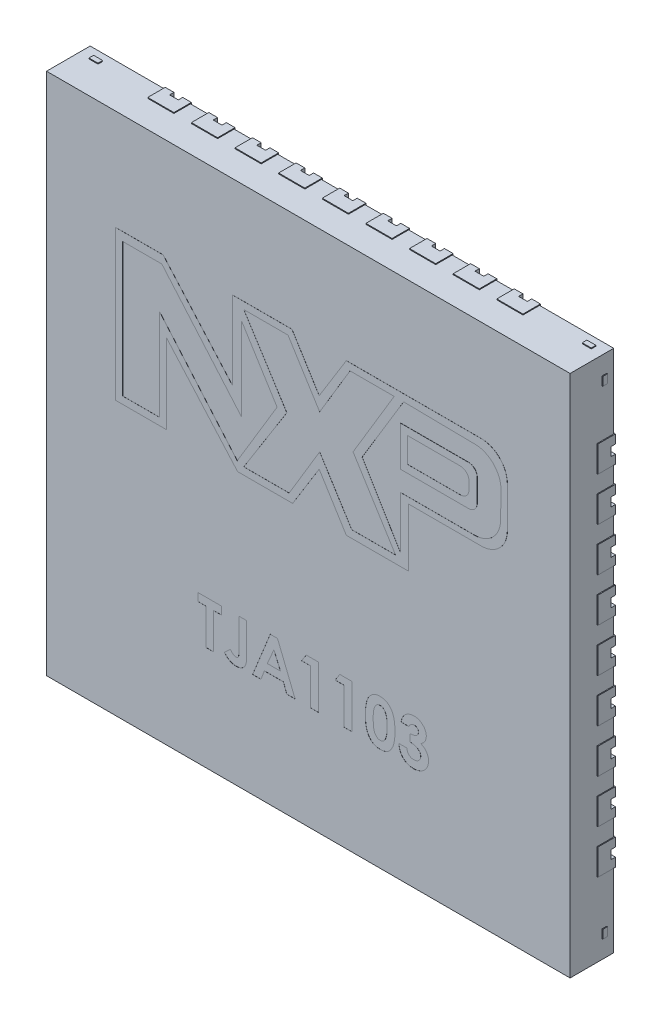
from build123d import *

# Parameters (mm, degrees)
SKETCH1_W           = 6
SKETCH1_H           = 6
BOSS_EXTRUDE1_DEPTH = 0.5
CUT_EXTRUDE2_DEPTH  = 0.001
BOSS_EXTRUDE2_DEPTH = 0.001
CUT_EXTRUDE3_DEPTH  = 0.001
BOSS_EXTRUDE3_DEPTH = 0.002
BOSS_EXTRUDE4_DEPTH = 0.01
SKETCH11_W          = 9.358912621
SKETCH11_H          = 9.422291262
SKETCH11_W_2        = 6
SKETCH11_H_2        = 6
CUT_EXTRUDE4_DEPTH  = 10.01
SKETCH14_W          = 0.3
SKETCH14_H          = 0.2
BOSS_EXTRUDE5_DEPTH = 0.01
SKETCH15_W          = 0.2
SKETCH15_H          = 0.3
BOSS_EXTRUDE6_DEPTH = 0.01
CUT_EXTRUDE6_DEPTH  = 0.05
SKETCH17_W          = 0.102885944
SKETCH17_H          = 0.053280221
BOSS_EXTRUDE7_DEPTH = 0.01
SKETCH18_W          = 0.053280221
SKETCH18_H          = 0.097122664
BOSS_EXTRUDE8_DEPTH = 0.01


with BuildPart() as part:
    # Sketch1 → Boss-Extrude1 (new body)
    with BuildSketch(Plane.XY):
        Rectangle(SKETCH1_W, SKETCH1_H)
    extrude(amount=BOSS_EXTRUDE1_DEPTH)

    # Sketch4 → Cut-Extrude2 (cut)
    with BuildSketch(Plane(origin=(0, 0, 0), x_dir=(-1, 0, 0), z_dir=(0, 0, -1))):
        with BuildLine():
            Line((-1.632420425, 1.980816377), (1.632420425, 1.980816377))
            ThreePointArc((1.632420425, 1.980816377), (1.809197121, 1.907593072), (1.882420425, 1.730816377))
            Line((1.882420425, 1.730816377), (1.882420425, 1.473194929))
            ThreePointArc((1.882420425, 1.473194929), (1.863122952, 1.414143238), (1.81267838, 1.377882515))
            ThreePointArc((1.81267838, 1.377882515), (1.651928824, 1.158195408), (1.81267838, 0.9385083))
            ThreePointArc((1.81267838, 0.9385083), (1.863122952, 0.902247578), (1.882420425, 0.843195886))
            Line((1.882420425, 0.843195886), (1.882420425, -1.730816377))
            ThreePointArc((1.882420425, -1.730816377), (1.809197121, -1.907593072), (1.632420425, -1.980816377))
            Line((1.632420425, -1.980816377), (-1.632420425, -1.980816377))
            ThreePointArc((-1.632420425, -1.980816377), (-1.809197121, -1.907593072), (-1.882420425, -1.730816377))
            Line((-1.882420425, -1.730816377), (-1.882420425, 1.730816377))
            ThreePointArc((-1.882420425, 1.730816377), (-1.809197121, 1.907593072), (-1.632420425, 1.980816377))
        make_face()
    extrude(amount=-CUT_EXTRUDE2_DEPTH, mode=Mode.SUBTRACT)

    # Sketch6 → Boss-Extrude2 (add)
    # profile 1 of 2: a face of its own
    with BuildSketch(Plane.XY.offset(0.5)):
        with BuildLine():
            Line((-2.208307901, 1.845529629), (-2.208307901, 0.13028037))
            Line((-2.208307901, 0.13028037), (-1.626258533, 0.13028037))
            Line((-1.626258533, 0.13028037), (-1.626258533, 1.045395534))
            Line((-1.626258533, 1.045395534), (-0.809326621, 0.121554782))
            Line((-0.809326621, 0.121554782), (-0.178530199, 0.121554782))
            Line((-0.178530199, 0.121554782), (0.125471171, 0.613755741))
            Line((0.125471171, 0.613755741), (0.436261306, 0.112710429))
            Line((0.436261306, 0.112710429), (1.148042249, 0.112710429))
            Line((1.148042249, 0.112710429), (1.148042249, 0.779423917))
            Line((1.148042249, 0.779423917), (1.981741709, 0.779423917))
            ThreePointArc((1.981741709, 0.779423917), (2.193873744, 0.867291883), (2.281741709, 1.079423917))
            Line((2.281741709, 1.079423917), (2.281741709, 1.545529629))
            ThreePointArc((2.281741709, 1.545529629), (2.193873744, 1.757661663), (1.981741709, 1.845529629))
            Line((1.981741709, 1.845529629), (0.436261306, 1.845529629))
            Line((0.436261306, 1.845529629), (0.125471171, 1.342337153))
            Line((0.125471171, 1.342337153), (-0.186650813, 1.845529629))
            Line((-0.186650813, 1.845529629), (-0.8659796, 1.845529629))
            Line((-0.8659796, 1.845529629), (-0.8659796, 0.944137734))
            Line((-0.8659796, 0.944137734), (-1.663060485, 1.845529629))
            Line((-1.663060485, 1.845529629), (-2.208307901, 1.845529629))
        make_face()
        Polygon((-1.703941314, 0.212969588), (-2.126234991, 0.212969588), (-2.126234991, 1.747783971), (-1.677731742, 1.747783971), (-0.764251952, 0.686588082), (-0.764251952, 1.640514179), (-0.356666128, 0.987426307), (-0.813519915, 0.227161378), (-1.703941314, 1.261570173), align=None, mode=Mode.SUBTRACT)
        Polygon((-0.245781204, 0.987426307), (-0.738994909, 1.765579058), (-0.231779744, 1.765579058), (0.130879269, 1.185075323), (0.478894984, 1.765579058), (0.985194292, 1.765579058), (0.513824476, 0.979315892), (1.00127257, 0.199063838), (0.498293295, 0.199063838), (0.130879269, 0.787178864), (-0.218681012, 0.204098736), (-0.738994909, 0.204098736), align=None, mode=Mode.SUBTRACT)
        with BuildLine():
            Line((0.61729453, 0.979315892), (1.093525415, 1.765579058))
            Line((1.093525415, 1.765579058), (1.913234367, 1.754090362))
            ThreePointArc((1.913234367, 1.754090362), (2.12411417, 1.663258164), (2.209000646, 1.449915562))
            Line((2.209000646, 1.449915562), (2.204711866, 1.143914681))
            ThreePointArc((2.204711866, 1.143914681), (2.115381686, 0.934505648), (1.904741327, 0.848118942))
            Line((1.904741327, 0.848118942), (1.059921224, 0.848118942))
            Line((1.059921224, 0.848118942), (1.059921224, 0.245206429))
            Line((1.059921224, 0.245206429), (0.61729453, 0.979315892))
        make_face(mode=Mode.SUBTRACT)
    # profile 2 of 2: a face of its own
    with BuildSketch(Plane.XY.offset(0.5)):
        with BuildLine():
            Line((1.743735016, 1.454393746), (1.140257386, 1.454393746))
            Line((1.140257386, 1.454393746), (1.140257386, 1.167858098))
            Line((1.140257386, 1.167858098), (1.743735016, 1.167858098))
            ThreePointArc((1.743735016, 1.167858098), (1.814445694, 1.19714742), (1.843735016, 1.267858098))
            Line((1.843735016, 1.267858098), (1.843735016, 1.354393746))
            ThreePointArc((1.843735016, 1.354393746), (1.814445694, 1.425104424), (1.743735016, 1.454393746))
        make_face()
    extrude(amount=BOSS_EXTRUDE2_DEPTH)

    # Sketch8 → Cut-Extrude3 (cut)
    # profile 1 of 7: a face of its own
    with BuildSketch(Plane.XY.offset(0.5)):
        Polygon((-1.263317536, -1.306398608), (-0.994086767, -1.306398608), (-0.994086767, -1.396142198), (-1.083830357, -1.396142198), (-1.083830357, -1.806398608), (-1.173573947, -1.806398608), (-1.173573947, -1.396142198), (-1.263317536, -1.396142198), align=None)
    # profile 2 of 7: a face of its own
    with BuildSketch(Plane.XY.offset(0.5)):
        with BuildLine():
            Line((-0.795368818, -1.306398608), (-0.705625229, -1.306398608))
            Line((-0.705625229, -1.306398608), (-0.705625229, -1.638329698))
            add(Edge.make_bspline(
                [(-0.705625229, -1.638329698), (-0.705658131, -1.644673799), (-0.705721528, -1.656897628), (-0.706356245, -1.674495431), (-0.707214493, -1.690629989), (-0.708450454, -1.705275451), (-0.710286194, -1.718431108), (-0.712363694, -1.730129782), (-0.714655753, -1.740419142), (-0.718527604, -1.751934537), (-0.724538539, -1.764686527), (-0.733609213, -1.778460488), (-0.744905105, -1.790427713), (-0.757914242, -1.800822632), (-0.772746234, -1.809053441), (-0.789059389, -1.815002691), (-0.806801556, -1.818556815), (-0.819090237, -1.818994028), (-0.825416895, -1.819219121)],
                knots=[0, 0, 0, 0, 1.22248561, 2.355488409, 3.392943897, 4.335991845, 5.186735882, 5.951517034, 6.625683685, 7.215700098, 8.28923535, 9.333114649, 10.380102123, 11.447198135, 12.530158036, 13.633358744, 14.781567393, 16, 16, 16, 16], degree=3))
            add(Edge.make_bspline(
                [(-0.825416895, -1.819219121), (-0.832008697, -1.819015046), (-0.845010305, -1.818612531), (-0.864078502, -1.815184139), (-0.882405423, -1.809687394), (-0.899896254, -1.80173976), (-0.916790625, -1.791784276), (-0.932781918, -1.779435466), (-0.94820401, -1.765076322), (-0.95734632, -1.754057475), (-0.962035485, -1.74840582)],
                knots=[0, 0, 0, 0, 0.990984786, 1.954608977, 2.90473533, 3.862451285, 4.837525908, 5.848096122, 6.896271184, 8, 8, 8, 8], degree=3))
            Line((-0.962035485, -1.74840582), (-0.894126831, -1.685605339))
            add(Edge.make_bspline(
                [(-0.894126831, -1.685605339), (-0.890571211, -1.689625741), (-0.883917689, -1.697148996), (-0.873891028, -1.706959504), (-0.864846439, -1.714841115), (-0.856320386, -1.720526192), (-0.848274554, -1.724533536), (-0.840535831, -1.727420139), (-0.832862992, -1.729054121), (-0.82779408, -1.729337187), (-0.825316735, -1.729475531)],
                knots=[0, 0, 0, 0, 1.529509877, 2.862124173, 3.996688592, 4.944357383, 5.774364335, 6.554177287, 7.293378699, 8, 8, 8, 8], degree=3))
            add(Edge.make_bspline(
                [(-0.825316735, -1.729475531), (-0.822918941, -1.72935049), (-0.818308772, -1.729110077), (-0.811969612, -1.726437583), (-0.806625293, -1.722241655), (-0.803106908, -1.717417891), (-0.800864766, -1.712486705), (-0.799463833, -1.707719957), (-0.798134346, -1.702005917), (-0.79706919, -1.69534745), (-0.796264357, -1.687657705), (-0.795863205, -1.679030035), (-0.795375354, -1.669417818), (-0.795371074, -1.66270285), (-0.795368818, -1.659163031)],
                knots=[0, 0, 0, 0, 1.003927327, 1.930222208, 2.840933547, 3.835773585, 4.407906147, 5.114514582, 5.922289074, 6.876303333, 7.950072246, 9.174518422, 10.510537432, 12, 12, 12, 12], degree=3))
            Line((-0.795368818, -1.659163031), (-0.795368818, -1.306398608))
        make_face()
    # profile 3 of 7: a face of its own
    with BuildSketch(Plane.XY.offset(0.5)):
        Polygon((-0.436294299, -1.306398608), (-0.353061126, -1.306398608), (-0.151138049, -1.806398608), (-0.246991414, -1.806398608), (-0.285853594, -1.703834506), (-0.503702152, -1.703834506), (-0.542564331, -1.806398608), (-0.638317536, -1.806398608), align=None)
        Polygon((-0.394727793, -1.440513191), (-0.469647664, -1.614090916), (-0.319807921, -1.614090916), align=None, mode=Mode.SUBTRACT)
    # profile 4 of 7: a face of its own
    with BuildSketch(Plane.XY.offset(0.5)):
        Polygon((-0.023834363, -1.306398608), (0.114887592, -1.306398608), (0.114887592, -1.806398608), (0.025144002, -1.806398608), (0.025144002, -1.389731941), (-0.0774201, -1.389731941), align=None)
    # profile 5 of 7: a face of its own
    with BuildSketch(Plane.XY.offset(0.5)):
        Polygon((0.360781021, -1.306398608), (0.499502977, -1.306398608), (0.499502977, -1.806398608), (0.409759387, -1.806398608), (0.409759387, -1.389731941), (0.307195284, -1.389731941), align=None)
    # profile 6 of 7: a face of its own
    with BuildSketch(Plane.XY.offset(0.5)):
        with BuildLine():
            add(Edge.make_bspline(
                [(0.821718521, -1.293578095), (0.826062484, -1.293642583), (0.834603874, -1.293769382), (0.847183734, -1.295142722), (0.859301618, -1.297217456), (0.871004931, -1.300110987), (0.882209433, -1.303940471), (0.892996672, -1.308524299), (0.903238248, -1.3141029), (0.913064775, -1.320404217), (0.922472467, -1.327538201), (0.931235217, -1.335671311), (0.939513051, -1.344616404), (0.947126786, -1.354508713), (0.954245028, -1.365258259), (0.96084439, -1.376866744), (0.96687435, -1.389390985), (0.972402491, -1.402853583), (0.977345773, -1.417456337), (0.981509492, -1.433366746), (0.985080579, -1.450588443), (0.988094827, -1.469164297), (0.990373112, -1.489118999), (0.991908722, -1.510439292), (0.992962531, -1.533084073), (0.993048535, -1.548618207), (0.99309272, -1.556598929)],
                knots=[0, 0, 0, 0, 0.879237366, 1.728815576, 2.559023295, 3.367336655, 4.166867292, 4.954216142, 5.737608147, 6.525189134, 7.316157332, 8.124696809, 8.942788509, 9.781158001, 10.649253743, 11.551476218, 12.482711956, 13.461909668, 14.496590415, 15.601789533, 16.789733467, 18.056700938, 19.410929216, 20.8549011, 22.384193279, 24, 24, 24, 24], degree=3))
            add(Edge.make_bspline(
                [(0.99309272, -1.556598929), (0.993044968, -1.564679498), (0.992952186, -1.580379899), (0.991952529, -1.603231801), (0.990231073, -1.624706892), (0.988012336, -1.64480295), (0.984973273, -1.663509362), (0.981414108, -1.680874567), (0.977184665, -1.696892268), (0.972078553, -1.711526376), (0.966583874, -1.725012617), (0.960537419, -1.737512439), (0.954044577, -1.749059698), (0.947254274, -1.7598286), (0.939794241, -1.769501684), (0.932027579, -1.778407884), (0.923616113, -1.786207952), (0.914913998, -1.793303869), (0.905602442, -1.799436165), (0.89577747, -1.80479937), (0.885263923, -1.809149567), (0.874253442, -1.812933135), (0.862558354, -1.815649329), (0.85036449, -1.817804539), (0.837534185, -1.818995641), (0.828798796, -1.819143405), (0.824322688, -1.819219121)],
                knots=[0, 0, 0, 0, 1.643780988, 3.193836972, 4.651895693, 6.025988579, 7.305620092, 8.505800249, 9.631074763, 10.672816429, 11.65661981, 12.592235626, 13.49536222, 14.350718032, 15.179365177, 15.97804903, 16.751647189, 17.51006938, 18.259804725, 19.016521909, 19.783502495, 20.571750527, 21.382245291, 22.22305063, 23.089471752, 24, 24, 24, 24], degree=3))
            add(Edge.make_bspline(
                [(0.824322688, -1.819219121), (0.819846701, -1.819141945), (0.811078307, -1.818990757), (0.798213307, -1.817813396), (0.785954822, -1.815640598), (0.774167206, -1.812912282), (0.7629325, -1.809157938), (0.752196833, -1.804677587), (0.742042754, -1.799347845), (0.732442146, -1.793201262), (0.723427791, -1.786152822), (0.714859603, -1.778277917), (0.706756538, -1.769596508), (0.699241862, -1.760011356), (0.692192506, -1.749650403), (0.685681986, -1.738395331), (0.679714212, -1.726262528), (0.674102512, -1.713235082), (0.669226656, -1.699032527), (0.66488737, -1.683528035), (0.661332741, -1.666592365), (0.658473871, -1.648230957), (0.65619135, -1.62848271), (0.654493417, -1.607338093), (0.653488208, -1.584787256), (0.653396399, -1.569286943), (0.65334913, -1.561306461)],
                knots=[0, 0, 0, 0, 0.917216111, 1.796812873, 2.643793957, 3.46689424, 4.273913431, 5.068098542, 5.848489301, 6.620921603, 7.401012384, 8.190319798, 9.003608147, 9.831726257, 10.68377682, 11.569763213, 12.493818149, 13.453288342, 14.474581811, 15.568529029, 16.750744269, 18.018426408, 19.375425659, 20.823733699, 22.36466933, 24, 24, 24, 24], degree=3))
            add(Edge.make_bspline(
                [(0.65334913, -1.561306461), (0.653434753, -1.550218208), (0.653599963, -1.528823283), (0.655693623, -1.497913836), (0.658766585, -1.469343407), (0.663280038, -1.443159787), (0.66886086, -1.419265999), (0.676007394, -1.397819443), (0.684143203, -1.378523358), (0.691075957, -1.367092241), (0.694414836, -1.361586909)],
                knots=[0, 0, 0, 0, 1.288568992, 2.486310467, 3.599230591, 4.627010532, 5.572937695, 6.447898582, 7.252493626, 8, 8, 8, 8], degree=3))
            add(Edge.make_bspline(
                [(0.694414836, -1.361586909), (0.698297124, -1.356178473), (0.705887764, -1.345603916), (0.71916021, -1.331721498), (0.733419725, -1.319848574), (0.748959191, -1.31025384), (0.765532846, -1.302687431), (0.783282982, -1.297343362), (0.802144051, -1.294229659), (0.815096262, -1.293798526), (0.821718521, -1.293578095)],
                knots=[0, 0, 0, 0, 1.058512271, 2.069600068, 3.047294572, 4.004278952, 4.967380941, 5.939006123, 6.946246673, 8, 8, 8, 8], degree=3))
        make_face()
        with BuildLine():
            add(Edge.make_bspline(
                [(0.823922047, -1.383321685), (0.819995069, -1.383507816), (0.812296108, -1.383872731), (0.801124548, -1.386970349), (0.790590465, -1.391754786), (0.78257747, -1.397512108), (0.776579822, -1.403031191), (0.772389223, -1.408025782), (0.76834805, -1.413599386), (0.764778683, -1.42000351), (0.761408269, -1.427008048), (0.758114358, -1.434644794), (0.755414216, -1.443101325), (0.752761398, -1.452233625), (0.750437282, -1.462294176), (0.748490183, -1.473365214), (0.74675062, -1.485518735), (0.745537255, -1.498762698), (0.744406034, -1.513083247), (0.743595122, -1.528512284), (0.743256099, -1.545045645), (0.743148335, -1.556431925), (0.74309272, -1.562308063)],
                knots=[0, 0, 0, 0, 1.076674018, 2.110852608, 3.161083442, 4.239746716, 4.804137807, 5.395870207, 6.026861976, 6.692161227, 7.405688833, 8.16177676, 8.973626916, 9.841385931, 10.773283133, 11.807421078, 12.927755683, 14.143907515, 15.458935494, 16.872852025, 18.386167141, 20, 20, 20, 20], degree=3))
            add(Edge.make_bspline(
                [(0.74309272, -1.562308063), (0.743184255, -1.569920884), (0.743359779, -1.584519033), (0.744279093, -1.605511679), (0.746121782, -1.624616677), (0.748413715, -1.64196351), (0.751632829, -1.657439677), (0.755336627, -1.671191598), (0.759910489, -1.68304397), (0.765196467, -1.693168203), (0.771050927, -1.701780868), (0.7774062, -1.709101672), (0.784045913, -1.715441142), (0.791177312, -1.720590616), (0.798783385, -1.724536936), (0.806800634, -1.727375474), (0.815234154, -1.729113062), (0.821009342, -1.72935401), (0.823922047, -1.729475531)],
                knots=[0, 0, 0, 0, 1.771748488, 3.397459088, 4.888034009, 6.237357457, 7.467047327, 8.564189669, 9.548206622, 10.417051504, 11.216568818, 11.965764335, 12.669334354, 13.348544111, 14.005342236, 14.656555988, 15.322436492, 16, 16, 16, 16], degree=3))
            add(Edge.make_bspline(
                [(0.823922047, -1.729475531), (0.826734798, -1.729392377), (0.832241813, -1.729229572), (0.840272275, -1.727558398), (0.847866451, -1.724841433), (0.855001411, -1.720998095), (0.861702676, -1.716110702), (0.867937495, -1.710157777), (0.873658845, -1.703079984), (0.876992129, -1.697827215), (0.878709707, -1.695120563)],
                knots=[0, 0, 0, 0, 0.992283464, 1.942767638, 2.88273346, 3.832339453, 4.79467288, 5.803907806, 6.868395428, 8, 8, 8, 8], degree=3))
            add(Edge.make_bspline(
                [(0.878709707, -1.695120563), (0.880731866, -1.69142201), (0.88497217, -1.683666443), (0.889879056, -1.670579213), (0.8940094, -1.65581898), (0.897564326, -1.63933981), (0.899995679, -1.621076707), (0.902089557, -1.601145477), (0.903099486, -1.579445757), (0.903263757, -1.564412112), (0.90334913, -1.556598929)],
                knots=[0, 0, 0, 0, 0.710965849, 1.490837728, 2.352621235, 3.297892224, 4.334225155, 5.461620853, 6.680770821, 8, 8, 8, 8], degree=3))
            add(Edge.make_bspline(
                [(0.90334913, -1.556598929), (0.903316152, -1.548717923), (0.903252675, -1.533548332), (0.902088057, -1.511770599), (0.900466238, -1.491880255), (0.898093984, -1.473921706), (0.895041647, -1.457851357), (0.891279632, -1.443670258), (0.886844495, -1.431350461), (0.881584952, -1.42090425), (0.87575968, -1.412026404), (0.869575977, -1.404409901), (0.863007694, -1.397907123), (0.856065817, -1.392493599), (0.848589673, -1.38835726), (0.840722065, -1.385436663), (0.832446865, -1.3836698), (0.826802008, -1.383439289), (0.823922047, -1.383321685)],
                knots=[0, 0, 0, 0, 1.793836731, 3.452829483, 4.963243077, 6.335886805, 7.574563692, 8.684454726, 9.672768357, 10.54971625, 11.340229787, 12.085688095, 12.778991901, 13.440269426, 14.083255152, 14.715733572, 15.344777694, 16, 16, 16, 16], degree=3))
        make_face(mode=Mode.SUBTRACT)
    # profile 7 of 7: a face of its own
    with BuildSketch(Plane.XY.offset(0.5)):
        with BuildLine():
            Line((1.15334913, -1.42819348), (1.063605541, -1.42819348))
            add(Edge.make_bspline(
                [(1.063605541, -1.42819348), (1.064239165, -1.423707518), (1.065481342, -1.414913087), (1.068453707, -1.402180941), (1.072008976, -1.39010363), (1.076447548, -1.378719399), (1.081653271, -1.36800797), (1.087573208, -1.357932585), (1.094271357, -1.348536492), (1.099405559, -1.342876247), (1.101966919, -1.340052454)],
                knots=[0, 0, 0, 0, 1.111473889, 2.178970933, 3.205615836, 4.199322666, 5.174200091, 6.12565194, 7.064921805, 8, 8, 8, 8], degree=3))
            add(Edge.make_bspline(
                [(1.101966919, -1.340052454), (1.105661341, -1.336326664), (1.11294266, -1.328983523), (1.125110596, -1.31957777), (1.137864841, -1.311437731), (1.151461186, -1.304984249), (1.165688062, -1.299760903), (1.180658606, -1.29625237), (1.196311642, -1.293924427), (1.20699287, -1.293695116), (1.212443682, -1.293578095)],
                knots=[0, 0, 0, 0, 1.01925491, 2.00884431, 2.983262333, 3.955970413, 4.92937149, 5.924503185, 6.940838805, 8, 8, 8, 8], degree=3))
            add(Edge.make_bspline(
                [(1.212443682, -1.293578095), (1.217289734, -1.293692501), (1.226816095, -1.2939174), (1.24081745, -1.295722765), (1.25416657, -1.298889174), (1.26700456, -1.303029183), (1.279142614, -1.308662357), (1.29084863, -1.315201273), (1.301795544, -1.323221525), (1.312008967, -1.332283603), (1.321391945, -1.342085128), (1.329517644, -1.352562151), (1.336503454, -1.363434809), (1.342258837, -1.374793431), (1.346683945, -1.386657238), (1.349755101, -1.398957695), (1.351765247, -1.411667659), (1.35196551, -1.42030645), (1.352067079, -1.424687871)],
                knots=[0, 0, 0, 0, 1.091422571, 2.145516843, 3.172569842, 4.178562979, 5.178154469, 6.181868002, 7.194278174, 8.227918432, 9.254613415, 10.245994977, 11.209837596, 12.161663635, 13.10878368, 14.055455738, 15.013766427, 16, 16, 16, 16], degree=3))
            add(Edge.make_bspline(
                [(1.352067079, -1.424687871), (1.351858653, -1.430113895), (1.351448325, -1.440796069), (1.34808129, -1.456430225), (1.342810965, -1.471379267), (1.335197467, -1.485434037), (1.325678656, -1.498556286), (1.313999393, -1.510307297), (1.300492335, -1.52087131), (1.290352406, -1.526548412), (1.285160028, -1.529455499)],
                knots=[0, 0, 0, 0, 0.992805628, 1.954529043, 2.915727527, 3.886831945, 4.871318353, 5.87440735, 6.911542536, 8, 8, 8, 8], degree=3))
            add(Edge.make_bspline(
                [(1.285160028, -1.529455499), (1.288723997, -1.530625625), (1.295727035, -1.53292487), (1.305681013, -1.537453207), (1.315146108, -1.542401929), (1.323959335, -1.54815104), (1.332208353, -1.55446807), (1.339842874, -1.56140702), (1.346908513, -1.56895276), (1.353289926, -1.577146789), (1.35895368, -1.58585806), (1.364035464, -1.594885346), (1.368218056, -1.604365548), (1.371761232, -1.614190397), (1.374458804, -1.624448192), (1.376358136, -1.635099186), (1.377455997, -1.646119083), (1.377623439, -1.653585057), (1.377708105, -1.657360147)],
                knots=[0, 0, 0, 0, 1.059543567, 2.081955587, 3.086750234, 4.076226789, 5.052108497, 6.020845489, 6.989030705, 7.970690546, 8.952259656, 9.923888338, 10.895517021, 11.877585046, 12.873342345, 13.889638361, 14.932918083, 16, 16, 16, 16], degree=3))
            add(Edge.make_bspline(
                [(1.377708105, -1.657360147), (1.377536476, -1.662907996), (1.37719806, -1.673847226), (1.375046569, -1.689959591), (1.37104088, -1.705321301), (1.365771173, -1.720109113), (1.358741957, -1.734132123), (1.350469752, -1.74771214), (1.340301549, -1.760378213), (1.329001337, -1.772465199), (1.316451794, -1.783454146), (1.302846047, -1.792981068), (1.288483276, -1.801156862), (1.27327261, -1.807794205), (1.257219336, -1.812905718), (1.240359234, -1.816600555), (1.222621462, -1.818861118), (1.210514045, -1.819098095), (1.204330701, -1.819219121)],
                knots=[0, 0, 0, 0, 1.005138573, 1.981928558, 2.936866704, 3.876260664, 4.820238198, 5.773547, 6.751179199, 7.756627054, 8.768222608, 9.766606018, 10.760583154, 11.757261445, 12.767156078, 13.807575856, 14.880313354, 16, 16, 16, 16], degree=3))
            add(Edge.make_bspline(
                [(1.204330701, -1.819219121), (1.198481357, -1.81909152), (1.187043739, -1.818842012), (1.170313829, -1.816682398), (1.154413633, -1.813198764), (1.139302574, -1.808288294), (1.125039115, -1.801920253), (1.111493909, -1.794337346), (1.098937248, -1.785102207), (1.087229227, -1.774631729), (1.076629564, -1.762884446), (1.067155961, -1.75013248), (1.059017313, -1.736327339), (1.052180244, -1.721528005), (1.046698203, -1.705708515), (1.042373986, -1.68890104), (1.039353449, -1.671072742), (1.038433538, -1.658806494), (1.037964515, -1.652552454)],
                knots=[0, 0, 0, 0, 1.066544725, 2.085487077, 3.070979577, 4.031932826, 4.977951092, 5.916076795, 6.857635327, 7.814973522, 8.776389752, 9.738577119, 10.707772778, 11.69409279, 12.707140348, 13.757286496, 14.856535458, 16, 16, 16, 16], degree=3))
            Line((1.037964515, -1.652552454), (1.127708105, -1.652552454))
            add(Edge.make_bspline(
                [(1.127708105, -1.652552454), (1.128276801, -1.655697068), (1.129384485, -1.661822027), (1.131544955, -1.670689606), (1.134360348, -1.67887493), (1.137615644, -1.686450748), (1.141131854, -1.693516529), (1.145380276, -1.699811317), (1.150049608, -1.70550604), (1.156787488, -1.712275989), (1.166419753, -1.719231829), (1.179426501, -1.725276785), (1.193895276, -1.728819872), (1.204010393, -1.729252118), (1.209238553, -1.729475531)],
                knots=[0, 0, 0, 0, 0.928156231, 1.807827665, 2.648129825, 3.438902246, 4.202261636, 4.936546065, 5.639352463, 6.338805438, 7.70633318, 9.064371875, 10.482673459, 12, 12, 12, 12], degree=3))
            add(Edge.make_bspline(
                [(1.209238553, -1.729475531), (1.2120128, -1.729427957), (1.217446929, -1.729334771), (1.225428855, -1.728301926), (1.233032764, -1.726600829), (1.240272818, -1.724289102), (1.247195107, -1.721391207), (1.253667374, -1.717654545), (1.259821542, -1.713310141), (1.265590707, -1.708425879), (1.270921534, -1.703103781), (1.275357096, -1.697210462), (1.279410879, -1.691221797), (1.282409085, -1.684745986), (1.285036161, -1.678131496), (1.286644065, -1.671138243), (1.287858148, -1.663912926), (1.287928706, -1.658968236), (1.287964515, -1.656458704)],
                knots=[0, 0, 0, 0, 1.110435564, 2.175094844, 3.216326037, 4.226890168, 5.215276772, 6.21526065, 7.213097102, 8.228249917, 9.239874822, 10.221364777, 11.178138315, 12.128914389, 13.072518965, 14.022636769, 14.996447288, 16, 16, 16, 16], degree=3))
            add(Edge.make_bspline(
                [(1.287964515, -1.656458704), (1.287869448, -1.653714103), (1.28768019, -1.648250231), (1.286133937, -1.64027686), (1.283692077, -1.632607118), (1.280300034, -1.625274973), (1.27577034, -1.618307449), (1.270425351, -1.611564756), (1.26384397, -1.605397839), (1.256623315, -1.599302028), (1.248250191, -1.59398832), (1.239132382, -1.589084548), (1.229030257, -1.585182659), (1.218190418, -1.58169755), (1.20640782, -1.579152081), (1.193755629, -1.577303822), (1.180254253, -1.575928079), (1.17094758, -1.575730706), (1.166169643, -1.575629377)],
                knots=[0, 0, 0, 0, 0.809814727, 1.612155564, 2.388397, 3.182215007, 3.988903953, 4.837162975, 5.715530372, 6.646997145, 7.623086902, 8.637258368, 9.698941581, 10.815059213, 11.996518529, 13.252603015, 14.589518788, 16, 16, 16, 16], degree=3))
            Line((1.166169643, -1.575629377), (1.166169643, -1.492296044))
            add(Edge.make_bspline(
                [(1.166169643, -1.492296044), (1.172118458, -1.491789424), (1.183247513, -1.490841638), (1.198695238, -1.488625208), (1.211700231, -1.485662584), (1.222575068, -1.482088338), (1.231604835, -1.477498075), (1.23949319, -1.472430628), (1.246287015, -1.466545529), (1.252028708, -1.460018271), (1.256621884, -1.453008607), (1.259872666, -1.445625489), (1.262019312, -1.43809736), (1.262222707, -1.432948347), (1.262323489, -1.430397006)],
                knots=[0, 0, 0, 0, 1.70044513, 3.18119609, 4.440695891, 5.496282586, 6.431922213, 7.318171381, 8.16090191, 8.983045123, 9.787564368, 10.536848927, 11.275007137, 12, 12, 12, 12], degree=3))
            add(Edge.make_bspline(
                [(1.262323489, -1.430397006), (1.262149611, -1.427141771), (1.261810238, -1.420788242), (1.25917448, -1.411695004), (1.254599102, -1.403589136), (1.248464324, -1.396487695), (1.240988884, -1.390556039), (1.232226358, -1.386249758), (1.222366892, -1.383719625), (1.215430227, -1.383457336), (1.21184272, -1.383321685)],
                knots=[0, 0, 0, 0, 1.009664648, 1.970651636, 2.907870547, 3.878035693, 4.867062054, 5.849714035, 6.887914197, 8, 8, 8, 8], degree=3))
            add(Edge.make_bspline(
                [(1.21184272, -1.383321685), (1.208591048, -1.383481739), (1.202138735, -1.383799335), (1.192703522, -1.386169787), (1.183743213, -1.390160148), (1.17544335, -1.39566262), (1.167923745, -1.402270857), (1.161752319, -1.410096941), (1.156619219, -1.418671999), (1.154443433, -1.425007211), (1.15334913, -1.42819348)],
                knots=[0, 0, 0, 0, 0.98818071, 1.960853194, 2.938124878, 3.957524365, 4.978590984, 5.968022688, 6.978025184, 8, 8, 8, 8], degree=3))
        make_face()
    extrude(amount=-CUT_EXTRUDE3_DEPTH, mode=Mode.SUBTRACT)

    # Sketch10 → Boss-Extrude3 (add)
    with BuildSketch(Plane.XY.offset(0.5)):
        with BuildLine():
            Line((1.059921224, 1.537389927), (1.837149806, 1.537389927))
            ThreePointArc((1.837149806, 1.537389927), (1.907860484, 1.508100605), (1.937149806, 1.437389927))
            Line((1.937149806, 1.437389927), (1.937149806, 1.179423917))
            ThreePointArc((1.937149806, 1.179423917), (1.907860484, 1.108713239), (1.837149806, 1.079423917))
            Line((1.837149806, 1.079423917), (1.059921224, 1.079423917))
            Line((1.059921224, 1.079423917), (1.059921224, 1.537389927))
        make_face()
        with BuildLine():
            Line((1.843735016, 1.354393746), (1.843735016, 1.267858098))
            ThreePointArc((1.843735016, 1.267858098), (1.814445694, 1.19714742), (1.743735016, 1.167858098))
            Line((1.743735016, 1.167858098), (1.140257386, 1.167858098))
            Line((1.140257386, 1.167858098), (1.140257386, 1.454393746))
            Line((1.140257386, 1.454393746), (1.743735016, 1.454393746))
            ThreePointArc((1.743735016, 1.454393746), (1.814445694, 1.425104424), (1.843735016, 1.354393746))
        make_face(mode=Mode.SUBTRACT)
    extrude(amount=BOSS_EXTRUDE3_DEPTH)

    # Sketch2 → Boss-Extrude4 (add)
    with BuildSketch(Plane(origin=(0, 0, 0), x_dir=(-1, 0, 0), z_dir=(0, 0, -1))):
        with BuildLine():
            Line((-2.15, 2.65), (-2.15, 3.35))
            ThreePointArc((-2.15, 3.35), (-2, 3.5), (-1.85, 3.35))
            Line((-1.85, 3.35), (-1.85, 2.65))
            ThreePointArc((-1.85, 2.65), (-2, 2.5), (-2.15, 2.65))
        make_face()
        with BuildLine():
            Line((-1.35, 2.65), (-1.35, 3.35))
            ThreePointArc((-1.35, 3.35), (-1.5, 3.5), (-1.65, 3.35))
            Line((-1.65, 3.35), (-1.65, 2.65))
            ThreePointArc((-1.65, 2.65), (-1.5, 2.5), (-1.35, 2.65))
        make_face()
        with BuildLine():
            Line((-0.85, 2.65), (-0.85, 3.35))
            ThreePointArc((-0.85, 3.35), (-1, 3.5), (-1.15, 3.35))
            Line((-1.15, 3.35), (-1.15, 2.65))
            ThreePointArc((-1.15, 2.65), (-1, 2.5), (-0.85, 2.65))
        make_face()
        with BuildLine():
            Line((-0.35, 2.65), (-0.35, 3.35))
            ThreePointArc((-0.35, 3.35), (-0.5, 3.5), (-0.65, 3.35))
            Line((-0.65, 3.35), (-0.65, 2.65))
            ThreePointArc((-0.65, 2.65), (-0.5, 2.5), (-0.35, 2.65))
        make_face()
        with BuildLine():
            Line((0.15, 2.65), (0.15, 3.35))
            ThreePointArc((0.15, 3.35), (0, 3.5), (-0.15, 3.35))
            Line((-0.15, 3.35), (-0.15, 2.65))
            ThreePointArc((-0.15, 2.65), (0, 2.5), (0.15, 2.65))
        make_face()
        with BuildLine():
            Line((0.65, 2.65), (0.65, 3.35))
            ThreePointArc((0.65, 3.35), (0.5, 3.5), (0.35, 3.35))
            Line((0.35, 3.35), (0.35, 2.65))
            ThreePointArc((0.35, 2.65), (0.5, 2.5), (0.65, 2.65))
        make_face()
        with BuildLine():
            Line((1.15, 2.65), (1.15, 3.35))
            ThreePointArc((1.15, 3.35), (1, 3.5), (0.85, 3.35))
            Line((0.85, 3.35), (0.85, 2.65))
            ThreePointArc((0.85, 2.65), (1, 2.5), (1.15, 2.65))
        make_face()
        with BuildLine():
            Line((1.65, 2.65), (1.65, 3.35))
            ThreePointArc((1.65, 3.35), (1.5, 3.5), (1.35, 3.35))
            Line((1.35, 3.35), (1.35, 2.65))
            ThreePointArc((1.35, 2.65), (1.5, 2.5), (1.65, 2.65))
        make_face()
        with BuildLine():
            Line((2.15, 2.65), (2.15, 3.35))
            ThreePointArc((2.15, 3.35), (2, 3.5), (1.85, 3.35))
            Line((1.85, 3.35), (1.85, 2.65))
            ThreePointArc((1.85, 2.65), (2, 2.5), (2.15, 2.65))
        make_face()
        with BuildLine():
            Line((-2.15, -2.65), (-2.15, -3.35))
            ThreePointArc((-2.15, -3.35), (-2, -3.5), (-1.85, -3.35))
            Line((-1.85, -3.35), (-1.85, -2.65))
            ThreePointArc((-1.85, -2.65), (-2, -2.5), (-2.15, -2.65))
        make_face()
        with BuildLine():
            Line((-1.65, -2.65), (-1.65, -3.35))
            ThreePointArc((-1.65, -3.35), (-1.5, -3.5), (-1.35, -3.35))
            Line((-1.35, -3.35), (-1.35, -2.65))
            ThreePointArc((-1.35, -2.65), (-1.5, -2.5), (-1.65, -2.65))
        make_face()
        with BuildLine():
            Line((-1.15, -2.65), (-1.15, -3.35))
            ThreePointArc((-1.15, -3.35), (-1, -3.5), (-0.85, -3.35))
            Line((-0.85, -3.35), (-0.85, -2.65))
            ThreePointArc((-0.85, -2.65), (-1, -2.5), (-1.15, -2.65))
        make_face()
        with BuildLine():
            Line((-0.65, -2.65), (-0.65, -3.35))
            ThreePointArc((-0.65, -3.35), (-0.5, -3.5), (-0.35, -3.35))
            Line((-0.35, -3.35), (-0.35, -2.65))
            ThreePointArc((-0.35, -2.65), (-0.5, -2.5), (-0.65, -2.65))
        make_face()
        with BuildLine():
            Line((-0.15, -2.65), (-0.15, -3.35))
            ThreePointArc((-0.15, -3.35), (0, -3.5), (0.15, -3.35))
            Line((0.15, -3.35), (0.15, -2.65))
            ThreePointArc((0.15, -2.65), (0, -2.5), (-0.15, -2.65))
        make_face()
        with BuildLine():
            Line((0.35, -2.65), (0.35, -3.35))
            ThreePointArc((0.35, -3.35), (0.5, -3.5), (0.65, -3.35))
            Line((0.65, -3.35), (0.65, -2.65))
            ThreePointArc((0.65, -2.65), (0.5, -2.5), (0.35, -2.65))
        make_face()
        with BuildLine():
            Line((0.85, -2.65), (0.85, -3.35))
            ThreePointArc((0.85, -3.35), (1, -3.5), (1.15, -3.35))
            Line((1.15, -3.35), (1.15, -2.65))
            ThreePointArc((1.15, -2.65), (1, -2.5), (0.85, -2.65))
        make_face()
        with BuildLine():
            Line((1.35, -2.65), (1.35, -3.35))
            ThreePointArc((1.35, -3.35), (1.5, -3.5), (1.65, -3.35))
            Line((1.65, -3.35), (1.65, -2.65))
            ThreePointArc((1.65, -2.65), (1.5, -2.5), (1.35, -2.65))
        make_face()
        with BuildLine():
            Line((1.85, -2.65), (1.85, -3.35))
            ThreePointArc((1.85, -3.35), (2, -3.5), (2.15, -3.35))
            Line((2.15, -3.35), (2.15, -2.65))
            ThreePointArc((2.15, -2.65), (2, -2.5), (1.85, -2.65))
        make_face()
        with BuildLine():
            Line((-2.65, 2.15), (-3.35, 2.15))
            ThreePointArc((-3.35, 2.15), (-3.5, 2), (-3.35, 1.85))
            Line((-3.35, 1.85), (-2.65, 1.85))
            ThreePointArc((-2.65, 1.85), (-2.5, 2), (-2.65, 2.15))
        make_face()
        with BuildLine():
            Line((-2.65, 1.65), (-3.35, 1.65))
            ThreePointArc((-3.35, 1.65), (-3.5, 1.5), (-3.35, 1.35))
            Line((-3.35, 1.35), (-2.65, 1.35))
            ThreePointArc((-2.65, 1.35), (-2.5, 1.5), (-2.65, 1.65))
        make_face()
        with BuildLine():
            Line((-2.65, 1.15), (-3.35, 1.15))
            ThreePointArc((-3.35, 1.15), (-3.5, 1), (-3.35, 0.85))
            Line((-3.35, 0.85), (-2.65, 0.85))
            ThreePointArc((-2.65, 0.85), (-2.5, 1), (-2.65, 1.15))
        make_face()
        with BuildLine():
            Line((-2.65, 0.65), (-3.35, 0.65))
            ThreePointArc((-3.35, 0.65), (-3.5, 0.5), (-3.35, 0.35))
            Line((-3.35, 0.35), (-2.65, 0.35))
            ThreePointArc((-2.65, 0.35), (-2.5, 0.5), (-2.65, 0.65))
        make_face()
        with BuildLine():
            Line((-2.65, 0.15), (-3.35, 0.15))
            ThreePointArc((-3.35, 0.15), (-3.5, 0), (-3.35, -0.15))
            Line((-3.35, -0.15), (-2.65, -0.15))
            ThreePointArc((-2.65, -0.15), (-2.5, 0), (-2.65, 0.15))
        make_face()
        with BuildLine():
            Line((-2.65, -0.35), (-3.35, -0.35))
            ThreePointArc((-3.35, -0.35), (-3.5, -0.5), (-3.35, -0.65))
            Line((-3.35, -0.65), (-2.65, -0.65))
            ThreePointArc((-2.65, -0.65), (-2.5, -0.5), (-2.65, -0.35))
        make_face()
        with BuildLine():
            Line((-2.65, -0.85), (-3.35, -0.85))
            ThreePointArc((-3.35, -0.85), (-3.5, -1), (-3.35, -1.15))
            Line((-3.35, -1.15), (-2.65, -1.15))
            ThreePointArc((-2.65, -1.15), (-2.5, -1), (-2.65, -0.85))
        make_face()
        with BuildLine():
            Line((-2.65, -1.35), (-3.35, -1.35))
            ThreePointArc((-3.35, -1.35), (-3.5, -1.5), (-3.35, -1.65))
            Line((-3.35, -1.65), (-2.65, -1.65))
            ThreePointArc((-2.65, -1.65), (-2.5, -1.5), (-2.65, -1.35))
        make_face()
        with BuildLine():
            Line((-2.65, -1.85), (-3.35, -1.85))
            ThreePointArc((-3.35, -1.85), (-3.5, -2), (-3.35, -2.15))
            Line((-3.35, -2.15), (-2.65, -2.15))
            ThreePointArc((-2.65, -2.15), (-2.5, -2), (-2.65, -1.85))
        make_face()
        with BuildLine():
            Line((2.65, 2.15), (3.35, 2.15))
            ThreePointArc((3.35, 2.15), (3.5, 2), (3.35, 1.85))
            Line((3.35, 1.85), (2.65, 1.85))
            ThreePointArc((2.65, 1.85), (2.5, 2), (2.65, 2.15))
        make_face()
        with BuildLine():
            Line((2.65, 1.65), (3.35, 1.65))
            ThreePointArc((3.35, 1.65), (3.5, 1.5), (3.35, 1.35))
            Line((3.35, 1.35), (2.65, 1.35))
            ThreePointArc((2.65, 1.35), (2.5, 1.5), (2.65, 1.65))
        make_face()
        with BuildLine():
            Line((2.65, 1.15), (3.35, 1.15))
            ThreePointArc((3.35, 1.15), (3.5, 1), (3.35, 0.85))
            Line((3.35, 0.85), (2.65, 0.85))
            ThreePointArc((2.65, 0.85), (2.5, 1), (2.65, 1.15))
        make_face()
        with BuildLine():
            Line((2.65, 0.65), (3.35, 0.65))
            ThreePointArc((3.35, 0.65), (3.5, 0.5), (3.35, 0.35))
            Line((3.35, 0.35), (2.65, 0.35))
            ThreePointArc((2.65, 0.35), (2.5, 0.5), (2.65, 0.65))
        make_face()
        with BuildLine():
            Line((2.65, 0.15), (3.35, 0.15))
            ThreePointArc((3.35, 0.15), (3.5, 0), (3.35, -0.15))
            Line((3.35, -0.15), (2.65, -0.15))
            ThreePointArc((2.65, -0.15), (2.5, 0), (2.65, 0.15))
        make_face()
        with BuildLine():
            Line((2.65, -0.35), (3.35, -0.35))
            ThreePointArc((3.35, -0.35), (3.5, -0.5), (3.35, -0.65))
            Line((3.35, -0.65), (2.65, -0.65))
            ThreePointArc((2.65, -0.65), (2.5, -0.5), (2.65, -0.35))
        make_face()
        with BuildLine():
            Line((2.65, -0.85), (3.35, -0.85))
            ThreePointArc((3.35, -0.85), (3.5, -1), (3.35, -1.15))
            Line((3.35, -1.15), (2.65, -1.15))
            ThreePointArc((2.65, -1.15), (2.5, -1), (2.65, -0.85))
        make_face()
        with BuildLine():
            Line((2.65, -1.35), (3.35, -1.35))
            ThreePointArc((3.35, -1.35), (3.5, -1.5), (3.35, -1.65))
            Line((3.35, -1.65), (2.65, -1.65))
            ThreePointArc((2.65, -1.65), (2.5, -1.5), (2.65, -1.35))
        make_face()
        with BuildLine():
            Line((2.65, -1.85), (3.35, -1.85))
            ThreePointArc((3.35, -1.85), (3.5, -2), (3.35, -2.15))
            Line((3.35, -2.15), (2.65, -2.15))
            ThreePointArc((2.65, -2.15), (2.5, -2), (2.65, -1.85))
        make_face()
    extrude(amount=BOSS_EXTRUDE4_DEPTH)

    # Sketch11 → Cut-Extrude4 (cut)
    with BuildSketch(Plane.XY.offset(0.5)):
        with Locations((-0.010563106, -0.401398058)):
            Rectangle(SKETCH11_W, SKETCH11_H)
        Rectangle(SKETCH11_W_2, SKETCH11_H_2, mode=Mode.SUBTRACT)
    extrude(amount=-CUT_EXTRUDE4_DEPTH, mode=Mode.SUBTRACT)

    # Sketch14 → Boss-Extrude5 (add)
    with BuildSketch(Plane.XZ.offset(3)):
        with Locations((-2, 0.09)):
            Rectangle(SKETCH14_W, SKETCH14_H)
        with Locations((-1.5, 0.09)):
            Rectangle(SKETCH14_W, SKETCH14_H)
        with Locations((-1, 0.09)):
            Rectangle(SKETCH14_W, SKETCH14_H)
        with Locations((-0.5, 0.09)):
            Rectangle(SKETCH14_W, SKETCH14_H)
        with Locations((0, 0.09)):
            Rectangle(SKETCH14_W, SKETCH14_H)
        with Locations((0.5, 0.09)):
            Rectangle(SKETCH14_W, SKETCH14_H)
        with Locations((1, 0.09)):
            Rectangle(SKETCH14_W, SKETCH14_H)
        with Locations((1.5, 0.09)):
            Rectangle(SKETCH14_W, SKETCH14_H)
        with Locations((2, 0.09)):
            Rectangle(SKETCH14_W, SKETCH14_H)
    boss_extrude5 = extrude(amount=BOSS_EXTRUDE5_DEPTH)

    # Sketch15 → Boss-Extrude6 (add)
    with BuildSketch(Plane.ZY.offset(3)):
        with Locations((0.09, -1.500001104)):
            Rectangle(SKETCH15_W, SKETCH15_H)
        with Locations((0.09, -2)):
            Rectangle(SKETCH15_W, SKETCH15_H)
        with Locations((0.09, -1.000002207)):
            Rectangle(SKETCH15_W, SKETCH15_H)
        with Locations((0.09, -0.500003311)):
            Rectangle(SKETCH15_W, SKETCH15_H)
        with Locations((0.09, -4.415e-06)):
            Rectangle(SKETCH15_W, SKETCH15_H)
        with Locations((0.09, 0.499994482)):
            Rectangle(SKETCH15_W, SKETCH15_H)
        with Locations((0.09, 0.999993378)):
            Rectangle(SKETCH15_W, SKETCH15_H)
        with Locations((0.09, 1.499992274)):
            Rectangle(SKETCH15_W, SKETCH15_H)
        with Locations((0.09, 1.99999117)):
            Rectangle(SKETCH15_W, SKETCH15_H)
    boss_extrude6 = extrude(amount=BOSS_EXTRUDE6_DEPTH)

    # Mirror1: Boss-Extrude6 across plane
    add(boss_extrude6.mirror(Plane(origin=(0, 0, 0), x_dir=(0, 0, 1), z_dir=(1, 0, 0))))

    # Mirror2: Boss-Extrude5 across plane
    add(boss_extrude5.mirror(Plane.ZX))

    # Sketch16 → Cut-Extrude6 (cut)
    with BuildSketch(Plane(origin=(0, 0, -0.01), x_dir=(-1, 0, 0), z_dir=(0, 0, -1))):
        with BuildLine():
            Line((-1.95, 3.06), (-1.95, 2.96))
            ThreePointArc((-1.95, 2.96), (-2, 2.91), (-2.05, 2.96))
            Line((-2.05, 2.96), (-2.05, 3.06))
            ThreePointArc((-2.05, 3.06), (-2, 3.11), (-1.95, 3.06))
        make_face()
        with BuildLine():
            Line((-1.55, 3.06), (-1.55, 2.96))
            ThreePointArc((-1.55, 2.96), (-1.5, 2.91), (-1.45, 2.96))
            Line((-1.45, 2.96), (-1.45, 3.06))
            ThreePointArc((-1.45, 3.06), (-1.5, 3.11), (-1.55, 3.06))
        make_face()
        with BuildLine():
            Line((-1.05, 3.06), (-1.05, 2.96))
            ThreePointArc((-1.05, 2.96), (-1, 2.91), (-0.95, 2.96))
            Line((-0.95, 2.96), (-0.95, 3.06))
            ThreePointArc((-0.95, 3.06), (-1, 3.11), (-1.05, 3.06))
        make_face()
        with BuildLine():
            Line((-0.55, 3.06), (-0.55, 2.96))
            ThreePointArc((-0.55, 2.96), (-0.5, 2.91), (-0.45, 2.96))
            Line((-0.45, 2.96), (-0.45, 3.06))
            ThreePointArc((-0.45, 3.06), (-0.5, 3.11), (-0.55, 3.06))
        make_face()
        with BuildLine():
            Line((-0.05, 3.06), (-0.05, 2.96))
            ThreePointArc((-0.05, 2.96), (0, 2.91), (0.05, 2.96))
            Line((0.05, 2.96), (0.05, 3.06))
            ThreePointArc((0.05, 3.06), (0, 3.11), (-0.05, 3.06))
        make_face()
        with BuildLine():
            Line((0.45, 3.06), (0.45, 2.96))
            ThreePointArc((0.45, 2.96), (0.5, 2.91), (0.55, 2.96))
            Line((0.55, 2.96), (0.55, 3.06))
            ThreePointArc((0.55, 3.06), (0.5, 3.11), (0.45, 3.06))
        make_face()
        with BuildLine():
            Line((0.95, 3.06), (0.95, 2.96))
            ThreePointArc((0.95, 2.96), (1, 2.91), (1.05, 2.96))
            Line((1.05, 2.96), (1.05, 3.06))
            ThreePointArc((1.05, 3.06), (1, 3.11), (0.95, 3.06))
        make_face()
        with BuildLine():
            Line((1.45, 3.06), (1.45, 2.96))
            ThreePointArc((1.45, 2.96), (1.5, 2.91), (1.55, 2.96))
            Line((1.55, 2.96), (1.55, 3.06))
            ThreePointArc((1.55, 3.06), (1.5, 3.11), (1.45, 3.06))
        make_face()
        with BuildLine():
            Line((1.95, 3.06), (1.95, 2.96))
            ThreePointArc((1.95, 2.96), (2, 2.91), (2.05, 2.96))
            Line((2.05, 2.96), (2.05, 3.06))
            ThreePointArc((2.05, 3.06), (2, 3.11), (1.95, 3.06))
        make_face()
        with BuildLine():
            Line((-1.95, -3.06), (-1.95, -2.96))
            ThreePointArc((-1.95, -2.96), (-2, -2.91), (-2.05, -2.96))
            Line((-2.05, -2.96), (-2.05, -3.06))
            ThreePointArc((-2.05, -3.06), (-2, -3.11), (-1.95, -3.06))
        make_face()
        with BuildLine():
            Line((-1.45, -3.06), (-1.45, -2.96))
            ThreePointArc((-1.45, -2.96), (-1.5, -2.91), (-1.55, -2.96))
            Line((-1.55, -2.96), (-1.55, -3.06))
            ThreePointArc((-1.55, -3.06), (-1.5, -3.11), (-1.45, -3.06))
        make_face()
        with BuildLine():
            Line((-0.95, -3.06), (-0.95, -2.96))
            ThreePointArc((-0.95, -2.96), (-1, -2.91), (-1.05, -2.96))
            Line((-1.05, -2.96), (-1.05, -3.06))
            ThreePointArc((-1.05, -3.06), (-1, -3.11), (-0.95, -3.06))
        make_face()
        with BuildLine():
            Line((-0.45, -3.06), (-0.45, -2.96))
            ThreePointArc((-0.45, -2.96), (-0.5, -2.91), (-0.55, -2.96))
            Line((-0.55, -2.96), (-0.55, -3.06))
            ThreePointArc((-0.55, -3.06), (-0.5, -3.11), (-0.45, -3.06))
        make_face()
        with BuildLine():
            Line((0.05, -3.06), (0.05, -2.96))
            ThreePointArc((0.05, -2.96), (0, -2.91), (-0.05, -2.96))
            Line((-0.05, -2.96), (-0.05, -3.06))
            ThreePointArc((-0.05, -3.06), (0, -3.11), (0.05, -3.06))
        make_face()
        with BuildLine():
            Line((0.55, -3.06), (0.55, -2.96))
            ThreePointArc((0.55, -2.96), (0.5, -2.91), (0.45, -2.96))
            Line((0.45, -2.96), (0.45, -3.06))
            ThreePointArc((0.45, -3.06), (0.5, -3.11), (0.55, -3.06))
        make_face()
        with BuildLine():
            Line((1.05, -3.06), (1.05, -2.96))
            ThreePointArc((1.05, -2.96), (1, -2.91), (0.95, -2.96))
            Line((0.95, -2.96), (0.95, -3.06))
            ThreePointArc((0.95, -3.06), (1, -3.11), (1.05, -3.06))
        make_face()
        with BuildLine():
            Line((1.55, -3.06), (1.55, -2.96))
            ThreePointArc((1.55, -2.96), (1.5, -2.91), (1.45, -2.96))
            Line((1.45, -2.96), (1.45, -3.06))
            ThreePointArc((1.45, -3.06), (1.5, -3.11), (1.55, -3.06))
        make_face()
        with BuildLine():
            Line((2.05, -3.06), (2.05, -2.96))
            ThreePointArc((2.05, -2.96), (2, -2.91), (1.95, -2.96))
            Line((1.95, -2.96), (1.95, -3.06))
            ThreePointArc((1.95, -3.06), (2, -3.11), (2.05, -3.06))
        make_face()
        with BuildLine():
            Line((-3.06, 2.04999117), (-2.96, 2.04999117))
            ThreePointArc((-2.96, 2.04999117), (-2.91, 1.99999117), (-2.96, 1.94999117))
            Line((-2.96, 1.94999117), (-3.06, 1.94999117))
            ThreePointArc((-3.06, 1.94999117), (-3.11, 1.99999117), (-3.06, 2.04999117))
        make_face()
        with BuildLine():
            Line((-3.06, 1.44999117), (-2.96, 1.44999117))
            ThreePointArc((-2.96, 1.44999117), (-2.91, 1.49999117), (-2.96, 1.54999117))
            Line((-2.96, 1.54999117), (-3.06, 1.54999117))
            ThreePointArc((-3.06, 1.54999117), (-3.11, 1.49999117), (-3.06, 1.44999117))
        make_face()
        with BuildLine():
            Line((-3.06, 0.94999117), (-2.96, 0.94999117))
            ThreePointArc((-2.96, 0.94999117), (-2.91, 0.99999117), (-2.96, 1.04999117))
            Line((-2.96, 1.04999117), (-3.06, 1.04999117))
            ThreePointArc((-3.06, 1.04999117), (-3.11, 0.99999117), (-3.06, 0.94999117))
        make_face()
        with BuildLine():
            Line((-3.06, 0.44999117), (-2.96, 0.44999117))
            ThreePointArc((-2.96, 0.44999117), (-2.91, 0.49999117), (-2.96, 0.54999117))
            Line((-2.96, 0.54999117), (-3.06, 0.54999117))
            ThreePointArc((-3.06, 0.54999117), (-3.11, 0.49999117), (-3.06, 0.44999117))
        make_face()
        with BuildLine():
            Line((-3.06, -0.05000883), (-2.96, -0.05000883))
            ThreePointArc((-2.96, -0.05000883), (-2.91, -8.83e-06), (-2.96, 0.04999117))
            Line((-2.96, 0.04999117), (-3.06, 0.04999117))
            ThreePointArc((-3.06, 0.04999117), (-3.11, -8.83e-06), (-3.06, -0.05000883))
        make_face()
        with BuildLine():
            Line((-3.06, -0.55000883), (-2.96, -0.55000883))
            ThreePointArc((-2.96, -0.55000883), (-2.91, -0.50000883), (-2.96, -0.45000883))
            Line((-2.96, -0.45000883), (-3.06, -0.45000883))
            ThreePointArc((-3.06, -0.45000883), (-3.11, -0.50000883), (-3.06, -0.55000883))
        make_face()
        with BuildLine():
            Line((-3.06, -1.05000883), (-2.96, -1.05000883))
            ThreePointArc((-2.96, -1.05000883), (-2.91, -1.00000883), (-2.96, -0.95000883))
            Line((-2.96, -0.95000883), (-3.06, -0.95000883))
            ThreePointArc((-3.06, -0.95000883), (-3.11, -1.00000883), (-3.06, -1.05000883))
        make_face()
        with BuildLine():
            Line((-3.06, -1.55000883), (-2.96, -1.55000883))
            ThreePointArc((-2.96, -1.55000883), (-2.91, -1.50000883), (-2.96, -1.45000883))
            Line((-2.96, -1.45000883), (-3.06, -1.45000883))
            ThreePointArc((-3.06, -1.45000883), (-3.11, -1.50000883), (-3.06, -1.55000883))
        make_face()
        with BuildLine():
            Line((-3.06, -2.05000883), (-2.96, -2.05000883))
            ThreePointArc((-2.96, -2.05000883), (-2.91, -2.00000883), (-2.96, -1.95000883))
            Line((-2.96, -1.95000883), (-3.06, -1.95000883))
            ThreePointArc((-3.06, -1.95000883), (-3.11, -2.00000883), (-3.06, -2.05000883))
        make_face()
        with BuildLine():
            Line((3.06, 2.04999117), (2.96, 2.04999117))
            ThreePointArc((2.96, 2.04999117), (2.91, 1.99999117), (2.96, 1.94999117))
            Line((2.96, 1.94999117), (3.06, 1.94999117))
            ThreePointArc((3.06, 1.94999117), (3.11, 1.99999117), (3.06, 2.04999117))
        make_face()
        with BuildLine():
            Line((3.06, 1.54999117), (2.96, 1.54999117))
            ThreePointArc((2.96, 1.54999117), (2.91, 1.49999117), (2.96, 1.44999117))
            Line((2.96, 1.44999117), (3.06, 1.44999117))
            ThreePointArc((3.06, 1.44999117), (3.11, 1.49999117), (3.06, 1.54999117))
        make_face()
        with BuildLine():
            Line((3.06, 1.04999117), (2.96, 1.04999117))
            ThreePointArc((2.96, 1.04999117), (2.91, 0.99999117), (2.96, 0.94999117))
            Line((2.96, 0.94999117), (3.06, 0.94999117))
            ThreePointArc((3.06, 0.94999117), (3.11, 0.99999117), (3.06, 1.04999117))
        make_face()
        with BuildLine():
            Line((3.06, 0.54999117), (2.96, 0.54999117))
            ThreePointArc((2.96, 0.54999117), (2.91, 0.49999117), (2.96, 0.44999117))
            Line((2.96, 0.44999117), (3.06, 0.44999117))
            ThreePointArc((3.06, 0.44999117), (3.11, 0.49999117), (3.06, 0.54999117))
        make_face()
        with BuildLine():
            Line((3.06, 0.04999117), (2.96, 0.04999117))
            ThreePointArc((2.96, 0.04999117), (2.91, -8.83e-06), (2.96, -0.05000883))
            Line((2.96, -0.05000883), (3.06, -0.05000883))
            ThreePointArc((3.06, -0.05000883), (3.11, -8.83e-06), (3.06, 0.04999117))
        make_face()
        with BuildLine():
            Line((3.06, -0.45000883), (2.96, -0.45000883))
            ThreePointArc((2.96, -0.45000883), (2.91, -0.50000883), (2.96, -0.55000883))
            Line((2.96, -0.55000883), (3.06, -0.55000883))
            ThreePointArc((3.06, -0.55000883), (3.11, -0.50000883), (3.06, -0.45000883))
        make_face()
        with BuildLine():
            Line((3.06, -0.95000883), (2.96, -0.95000883))
            ThreePointArc((2.96, -0.95000883), (2.91, -1.00000883), (2.96, -1.05000883))
            Line((2.96, -1.05000883), (3.06, -1.05000883))
            ThreePointArc((3.06, -1.05000883), (3.11, -1.00000883), (3.06, -0.95000883))
        make_face()
        with BuildLine():
            Line((3.06, -1.45000883), (2.96, -1.45000883))
            ThreePointArc((2.96, -1.45000883), (2.91, -1.50000883), (2.96, -1.55000883))
            Line((2.96, -1.55000883), (3.06, -1.55000883))
            ThreePointArc((3.06, -1.55000883), (3.11, -1.50000883), (3.06, -1.45000883))
        make_face()
        with BuildLine():
            Line((3.06, -1.95000883), (2.96, -1.95000883))
            ThreePointArc((2.96, -1.95000883), (2.91, -2.00000883), (2.96, -2.05000883))
            Line((2.96, -2.05000883), (3.06, -2.05000883))
            ThreePointArc((3.06, -2.05000883), (3.11, -2.00000883), (3.06, -1.95000883))
        make_face()
    extrude(amount=-CUT_EXTRUDE6_DEPTH, mode=Mode.SUBTRACT)

    # Sketch17 → Boss-Extrude7 (add)
    with BuildSketch(Plane(origin=(0, 3, 0), x_dir=(1, 0, 0), z_dir=(0, 1, 0))):
        with Locations((-2.82646638, -0.10888348)):
            Rectangle(SKETCH17_W, SKETCH17_H)
        with Locations((2.82646638, -0.10888348)):
            Rectangle(SKETCH17_W, SKETCH17_H)
    boss_extrude7 = extrude(amount=BOSS_EXTRUDE7_DEPTH)

    # Mirror3: Boss-Extrude7 across plane
    add(boss_extrude7.mirror(Plane.ZX))

    # Sketch18 → Boss-Extrude8 (add)
    with BuildSketch(Plane.ZY.offset(3)):
        with Locations((0.10888348, -2.743920985)):
            Rectangle(SKETCH18_W, SKETCH18_H)
        with Locations((0.10888348, 2.743920985)):
            Rectangle(SKETCH18_W, SKETCH18_H)
    boss_extrude8 = extrude(amount=BOSS_EXTRUDE8_DEPTH)

    # Mirror4: Boss-Extrude8 across plane
    add(boss_extrude8.mirror(Plane(origin=(0, 0, 0), x_dir=(0, 0, 1), z_dir=(1, 0, 0))))


solid = part.part
